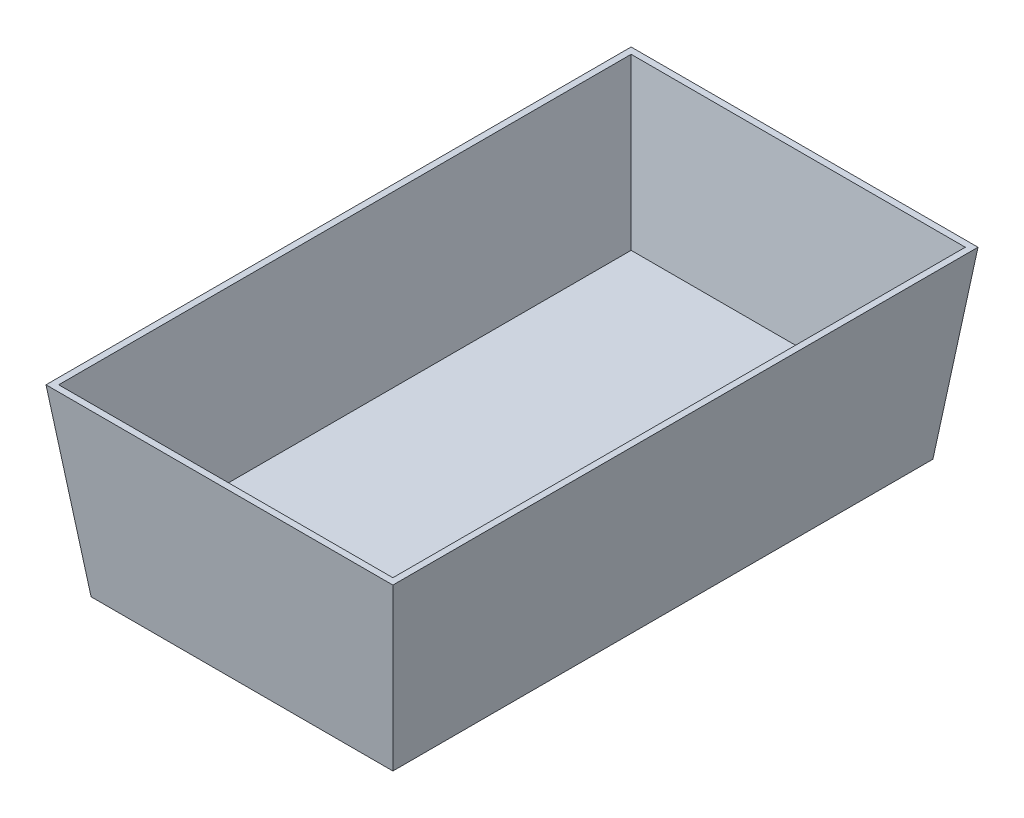
from build123d import *

# Parameters (mm, degrees)
SKETCH_1_W          = 475
SKETCH_1_H          = 850
EXTRUDE_1_DEPTH     = 289
EXTRUDE_1_DRAFT     = -7
SKETCH_2_W          = 525.969476202
SKETCH_2_H          = 900.969476202
CUT_EXTRUDE_1_DEPTH = 238
CUT_EXTRUDE_1_DRAFT = -7


with BuildPart() as part:
    # Эскиз1 → Бобышка-Вытянуть1 (with draft: the straight prism first)
    with BuildSketch(Plane(origin=(0, 0, 0), x_dir=(1, 0, 0), z_dir=(0, 1, 0))):
        with Locations((-465.395753162, -130.652339489)):
            Rectangle(SKETCH_1_W, SKETCH_1_H)
    extrude(amount=EXTRUDE_1_DEPTH)
    # Бобышка-Вытянуть1: the draft: its side faces are tilted about the plane it starts from
    extrude_1_sides = [part.faces().sort_by_distance(p)[0] for p in [
        (-465.395753162, 144.5, -294.347660511),
        (-702.895753162, 144.5, 130.652339489),
        (-465.395753162, 144.5, 555.652339489),
        (-227.895753162, 144.5, 130.652339489),
    ]]
    draft(extrude_1_sides, Plane(origin=(0, 0, 0), x_dir=(1, 0, 0), z_dir=(0, 1, 0)), EXTRUDE_1_DRAFT)


with BuildPart() as cut_extrude_1_tool:
    # Эскиз2 → Вырез-Вытянуть1 (with draft: the straight prism first)
    with BuildSketch(Plane(origin=(0, 289, 0), x_dir=(1, 0, 0), z_dir=(0, 1, 0))):
        with Locations((-465.395753162, -130.652339489)):
            Rectangle(SKETCH_2_W, SKETCH_2_H)
    extrude(amount=-CUT_EXTRUDE_1_DEPTH)
    # Вырез-Вытянуть1: the draft: its side faces are tilted about the plane it starts from
    cut_extrude_1_sides = [cut_extrude_1_tool.faces().sort_by_distance(p)[0] for p in [
        (-728.380491263, 170, 130.652339489),
        (-465.395753162, 170, 581.13707759),
        (-202.411015061, 170, 130.652339489),
        (-465.395753162, 170, -319.832398612),
    ]]
    draft(cut_extrude_1_sides, Plane(origin=(0, 289, 0), x_dir=(1, 0, 0), z_dir=(0, 1, 0)), CUT_EXTRUDE_1_DRAFT)


with BuildPart() as part_1:
    add(part.part)

    # Вырез-Вытянуть1: cut by cut_extrude_1_tool
    add(cut_extrude_1_tool.part, mode=Mode.SUBTRACT)


solid = part_1.part
